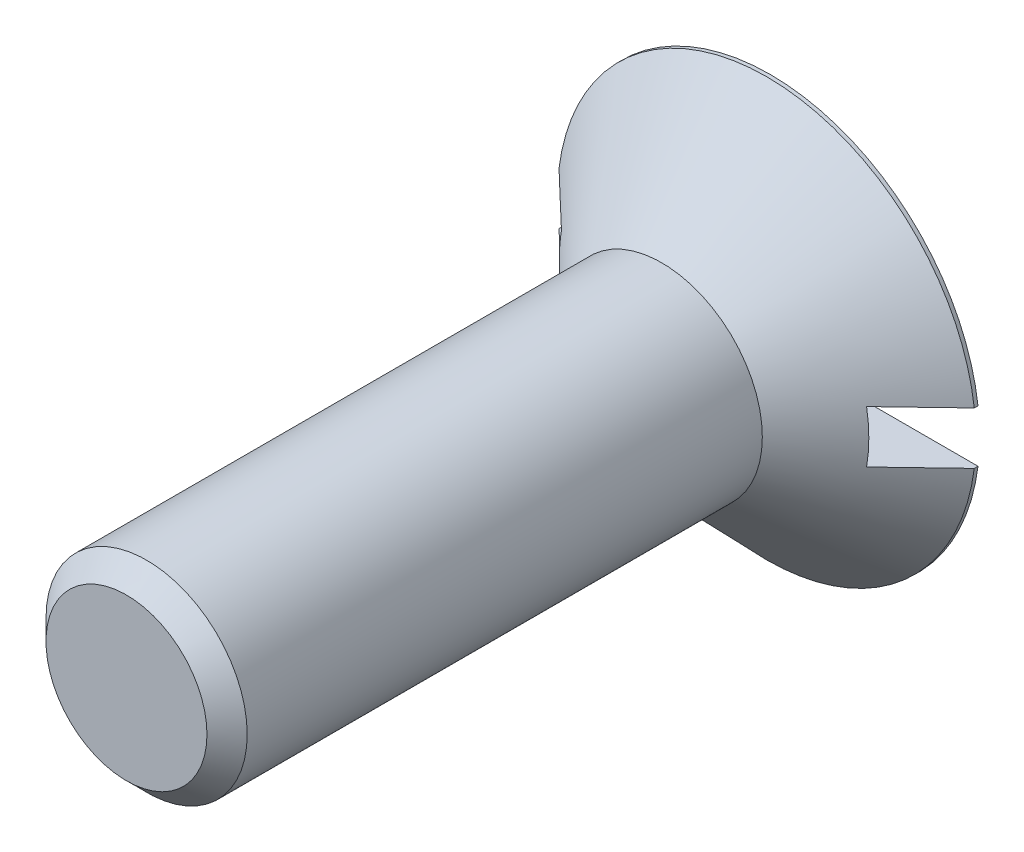
from build123d import *

# Parameters (mm, degrees)
ESQUISSE2_W     = 10.4
ESQUISSE2_H     = 1.3
FENTE1_DEPTH    = 1.4
ESQUISSE3_W     = 2.5
ESQUISSE3_H     = 13.3
CHANFREIN1_SIZE = 0.5


with BuildPart() as part:
    # Esquisse1 → Base-Révolution (revolve)
    with BuildSketch(Plane(origin=(0, 0, 0), x_dir=(1, 0, 0), z_dir=(0, 1, 0))):
        Polygon((2.5, 0), (5.2, 2.607359692), (5.2, 2.7), (0, 2.7), (0, 0), align=None)
    revolve(axis=Axis((0, 0, 0), (0, 0, -1)))

    # Esquisse2 → fente1 (cut)
    with BuildSketch(Plane.XY.offset(-2.7)):
        Rectangle(ESQUISSE2_W, ESQUISSE2_H)
    extrude(amount=FENTE1_DEPTH, mode=Mode.SUBTRACT)

    # Esquisse3 → Boss.-Révol.1 (revolve)
    with BuildSketch(Plane(origin=(0, 0, 0), x_dir=(1, 0, 0), z_dir=(0, 1, 0))):
        with Locations((1.25, -6.65)):
            Rectangle(ESQUISSE3_W, ESQUISSE3_H)
    revolve(axis=Axis((0, 0, 0), (0, 0, 1)))

    # Chanfrein1
    chanfrein1_edges = [part.edges().sort_by_distance(p)[0] for p in [
        (-2.5, 0, 13.3),
    ]]
    chamfer(chanfrein1_edges, length=CHANFREIN1_SIZE)


solid = part.part
